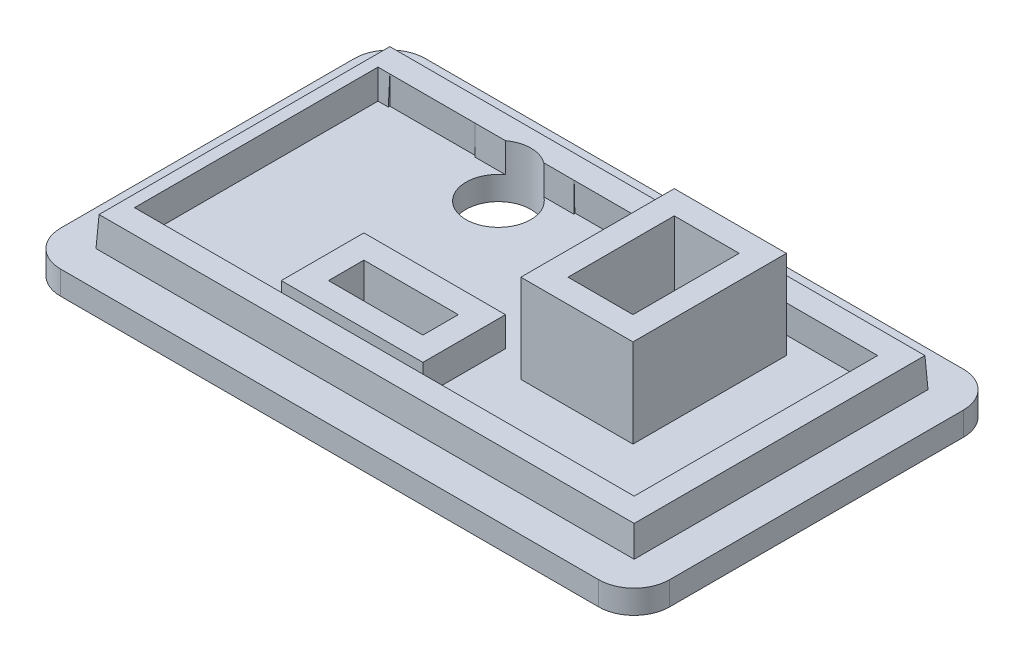
from build123d import *

# Parameters (mm, degrees)
CROQUIS1_W              = 45.6
CROQUIS1_H              = 24.9
SALIENTE_EXTRUIR1_DEPTH = 2.5
SALIENTE_EXTRUIR1_TAPER = 3
CROQUIS2_W              = 51.6
CROQUIS2_H              = 30.9
SALIENTE_EXTRUIR2_DEPTH = 2
REDONDEO1_R             = 3
CROQUIS3_R              = 2.75
CROQUIS3_W              = 8
CROQUIS3_H              = 3
CROQUIS3_W_2            = 5.5
CROQUIS3_H_2            = 9
CORTAR_EXTRUIR1_DEPTH   = 5
VACIADO1_START          = -10.447255308
VACIADO1_OUTLINE_W      = 2.9
VACIADO1_OUTLINE_H      = 2.5
VACIADO1_DEPTH          = 20.894510616
VACIADO1_2_OUTLINE_W    = 12
VACIADO1_2_OUTLINE_H    = 2.5
VACIADO1_2_DEPTH        = 12.897255308
VACIADO1_START_2        = 4.05
VACIADO1_3_OUTLINE_W    = 9.5
VACIADO1_3_OUTLINE_H    = 2.5
VACIADO1_3_DEPTH        = 6.397255308
VACIADO1_4_OUTLINE_W    = 9.5
VACIADO1_4_OUTLINE_H    = 2.5
VACIADO1_4_DEPTH        = 1.497255308
VACIADO1_START_3        = 9.45
VACIADO1_5_OUTLINE_W    = 12
VACIADO1_5_OUTLINE_H    = 2.5
VACIADO1_5_DEPTH        = 0.997255308
VACIADO1_START_4        = -7.073070686
VACIADO1_6_DEPTH        = 29.742051238
VACIADO1_START_5        = -22.668980552
VACIADO1_7_DEPTH        = 10.789333394
VACIADO1_START_6        = -12.0000001
VACIADO1_8_DEPTH        = 5.350388625
VACIADO1_9_DEPTH        = 2.5
CROQUIS4_W              = 1.002744692
CROQUIS4_H              = 20.63247172
CORTAR_EXTRUIR2_DEPTH   = 2.5
CROQUIS6_W              = 9.5
CROQUIS6_H              = 13
CROQUIS6_W_2            = 5.5
CROQUIS6_H_2            = 9
SALIENTE_EXTRUIR3_DEPTH = 5
CROQUIS7_W              = 15.957634565
CROQUIS7_H              = 9.76050456
CORTAR_EXTRUIR3_DEPTH   = 2.5


with BuildPart() as part:
    # Croquis1 → Saliente-Extruir1 (new body)
    with BuildSketch(Plane(origin=(0, 0, 0), x_dir=(1, 0, 0), z_dir=(0, 1, 0))):
        Rectangle(CROQUIS1_W, CROQUIS1_H)
    extrude(amount=SALIENTE_EXTRUIR1_DEPTH, taper=SALIENTE_EXTRUIR1_TAPER)

    # Croquis2 → Saliente-Extruir2 (add)
    with BuildSketch(Plane.XZ):
        Rectangle(CROQUIS2_W, CROQUIS2_H)
    extrude(amount=SALIENTE_EXTRUIR2_DEPTH)

    # Redondeo1
    redondeo1_edges = [part.edges().sort_by_distance(p)[0] for p in [
        (-25.8, -1, 15.45),
        (-25.8, -1, -15.45),
        (25.8, -1, -15.45),
        (25.8, -1, 15.45),
    ]]
    fillet(redondeo1_edges, radius=REDONDEO1_R)

    # Croquis3 → Cortar-Extruir1 (cut)
    with BuildSketch(Plane.XZ.offset(2)):
        with Locations(Location((-9.25, -8.1, 0), (0, 0, 270))):
            Circle(CROQUIS3_R)
        with Locations((-4.1, 5.95)):
            Rectangle(CROQUIS3_W, CROQUIS3_H)
        with Locations((9.55, -2.45)):
            Rectangle(CROQUIS3_W_2, CROQUIS3_H_2)
    extrude(amount=-CORTAR_EXTRUIR1_DEPTH, mode=Mode.SUBTRACT)

    # Vaciado1: read off the stored shape, not the designer's step
    # Vaciado1 outline → Vaciado1 (cut)
    with BuildSketch(Plane.XY.offset(VACIADO1_START)):
        Polygon((-20.66623586, 2.5), (-20.797255308, 0), (-10.1, 0), (-10.1, 2.5), align=None)
        with Locations((3.35, 1.25)):
            Rectangle(VACIADO1_OUTLINE_W, VACIADO1_OUTLINE_H)
        Polygon((14.3, 2.5), (14.3, 0), (20.797255308, 0), (20.66623586, 2.5), align=None)
    extrude(amount=VACIADO1_DEPTH, mode=Mode.SUBTRACT)

    # Vaciado1 2 outline → Vaciado1 2 (cut)
    with BuildSketch(Plane.XY.offset(VACIADO1_START)):
        with Locations((-4.1, 1.25)):
            Rectangle(VACIADO1_2_OUTLINE_W, VACIADO1_2_OUTLINE_H)
    extrude(amount=VACIADO1_2_DEPTH, mode=Mode.SUBTRACT)

    # Vaciado1 3 outline → Vaciado1 3 (cut)
    with BuildSketch(Plane.XY.offset(VACIADO1_START_2)):
        with Locations((9.55, 1.25)):
            Rectangle(VACIADO1_3_OUTLINE_W, VACIADO1_3_OUTLINE_H)
    extrude(amount=VACIADO1_3_DEPTH, mode=Mode.SUBTRACT)

    # Vaciado1 4 outline → Vaciado1 4 (cut)
    with BuildSketch(Plane.XY.offset(VACIADO1_START)):
        with Locations((9.55, 1.25)):
            Rectangle(VACIADO1_4_OUTLINE_W, VACIADO1_4_OUTLINE_H)
    extrude(amount=VACIADO1_4_DEPTH, mode=Mode.SUBTRACT)

    # Vaciado1 5 outline → Vaciado1 5 (cut)
    with BuildSketch(Plane.XY.offset(VACIADO1_START_3)):
        with Locations((-4.1, 1.25)):
            Rectangle(VACIADO1_5_OUTLINE_W, VACIADO1_5_OUTLINE_H)
    extrude(amount=VACIADO1_5_DEPTH, mode=Mode.SUBTRACT)

    # Vaciado1 6 outline → Vaciado1 6 (add)
    with BuildSketch(Plane.YZ.offset(VACIADO1_START_4)):
        Polygon((0, -10.447255308), (2.5, -10.447255308), (2.5, -10.31623586), align=None)
        Polygon((0, 10.447255308), (2.5, 10.31623586), (2.5, 10.447255308), align=None)
    extrude(amount=VACIADO1_6_DEPTH)

    # Vaciado1 7 outline → Vaciado1 7 (add)
    with BuildSketch(Plane.YZ.offset(VACIADO1_START_5)):
        Polygon((0, -10.447255308), (2.5, -10.447255308), (2.5, -10.31623586), align=None)
        Polygon((0, 10.447255308), (2.5, 10.31623586), (2.5, 10.447255308), align=None)
    extrude(amount=VACIADO1_7_DEPTH)

    # Vaciado1 8 outline → Vaciado1 8 (add)
    with BuildSketch(Plane.YZ.offset(VACIADO1_START_6)):
        Polygon((0, 10.447255308), (2.5, 10.31623586), (2.5, 10.447255308), align=None)
    extrude(amount=VACIADO1_8_DEPTH)

    # Vaciado1 9 outline → Vaciado1 9 (add)
    with BuildSketch(Plane(origin=(0, 0, 0), x_dir=(1, 0, 0), z_dir=(0, 1, 0))):
        with BuildLine():
            ThreePointArc((-7.817208138, 10.447255308), (-9.25, 5.35), (-10.682791862, 10.447255308))
            Line((-10.682791862, 10.447255308), (-13.379514804, 10.447255308))
            ThreePointArc((-13.379514804, 10.447255308), (-9.25, 3.35), (-5.120485196, 10.447255308))
            Line((-5.120485196, 10.447255308), (-7.817208138, 10.447255308))
        make_face()
    extrude(amount=VACIADO1_9_DEPTH)

    # Croquis4 → Cortar-Extruir2 (cut)
    with BuildSketch(Plane(origin=(0, 2.5, 0), x_dir=(1, 0, 0), z_dir=(0, 1, 0))):
        with Locations((-21.167608206, 0)):
            Rectangle(CROQUIS4_W, CROQUIS4_H)
    extrude(amount=-CORTAR_EXTRUIR2_DEPTH, mode=Mode.SUBTRACT)

    # Croquis6 → Saliente-Extruir3 (add)
    with BuildSketch(Plane(origin=(0, 2.5, 0), x_dir=(1, 0, 0), z_dir=(0, 1, 0))):
        with Locations((9.55, 2.45)):
            Rectangle(CROQUIS6_W, CROQUIS6_H)
        with Locations((9.55, 2.45)):
            Rectangle(CROQUIS6_W_2, CROQUIS6_H_2, mode=Mode.SUBTRACT)
    extrude(amount=SALIENTE_EXTRUIR3_DEPTH)

    # Croquis7 → Cortar-Extruir3 (cut)
    with BuildSketch(Plane(origin=(0, 2.5, 0), x_dir=(1, 0, 0), z_dir=(0, 1, 0))):
        with Locations((-9.332505864, 5.43598358)):
            Rectangle(CROQUIS7_W, CROQUIS7_H)
    extrude(amount=-CORTAR_EXTRUIR3_DEPTH, mode=Mode.SUBTRACT)


solid = part.part
